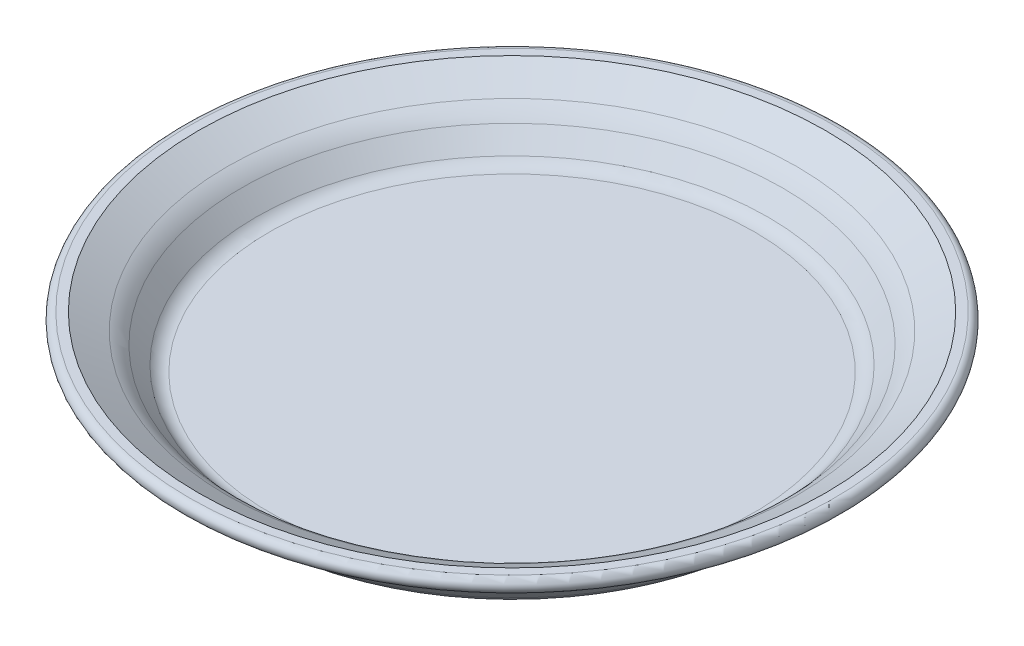
from build123d import *

# Parameters (mm, degrees)
SKETCH1_R           = 100
BOSS_EXTRUDE1_DEPTH = 10
BOSS_EXTRUDE1_DRAFT = -60
SKETCH2_R           = 82.679491924
BOSS_EXTRUDE2_DEPTH = 10
BOSS_EXTRUDE2_TAPER = 40
FILLET1_R           = 10
FILLET2_R           = 2


# Read off the part's stored shape, not the designer's step: Shell2
with BuildPart() as part:
    # Sketch1 → Boss-Extrude1 (with draft: the straight prism first)
    with BuildSketch(Plane(origin=(0, 0, 0), x_dir=(1, 0, 0), z_dir=(0, 1, 0))):
        Circle(SKETCH1_R)
    extrude(amount=-BOSS_EXTRUDE1_DEPTH)
    # Boss-Extrude1: the draft: its side faces are tilted about the plane it starts from
    boss_extrude1_sides = [part.faces().sort_by_distance(p)[0] for p in [
        (-100, -5, 0),
    ]]
    draft(boss_extrude1_sides, Plane(origin=(0, 0, 0), x_dir=(1, 0, 0), z_dir=(0, 1, 0)), BOSS_EXTRUDE1_DRAFT)

    # Sketch2 → Boss-Extrude2 (add)
    with BuildSketch(Plane.XZ.offset(10)):
        Circle(SKETCH2_R)
    extrude(amount=BOSS_EXTRUDE2_DEPTH, taper=BOSS_EXTRUDE2_TAPER)

    # Fillet1
    fillet1_edges = [part.edges().sort_by_distance(p)[0] for p in [
        (-82.679491924, -10, 0),
        (-74.288495613, -20, 0),
    ]]
    fillet(fillet1_edges, radius=FILLET1_R)

    # Fillet2
    fillet2_edges = [part.edges().sort_by_distance(p)[0] for p in [
        (-100, 0, 0),
    ]]
    fillet(fillet2_edges, radius=FILLET2_R)

    # Shell2 outline → Shell2 (revolve, cut)
    with BuildSketch(Plane.XY):
        with BuildLine():
            ThreePointArc((77.715861724, -8.136804989), (79.564714226, -6.287952488), (81.706528371, -4.788238078))
            Line((81.706528371, -4.788238078), (90, 0))
            Line((90, 0), (0, 0))
            Line((0, 0), (0, -15))
            Line((0, -15), (69.625419031, -15))
            ThreePointArc((69.625419031, -15), (71.73851034, -14.531538935), (73.455641247, -13.213938048))
            Line((73.455641247, -13.213938048), (77.715861724, -8.136804989))
        make_face()
    revolve(axis=Axis((0, 0, 0), (0, 1, 0)), mode=Mode.SUBTRACT)


solid = part.part
